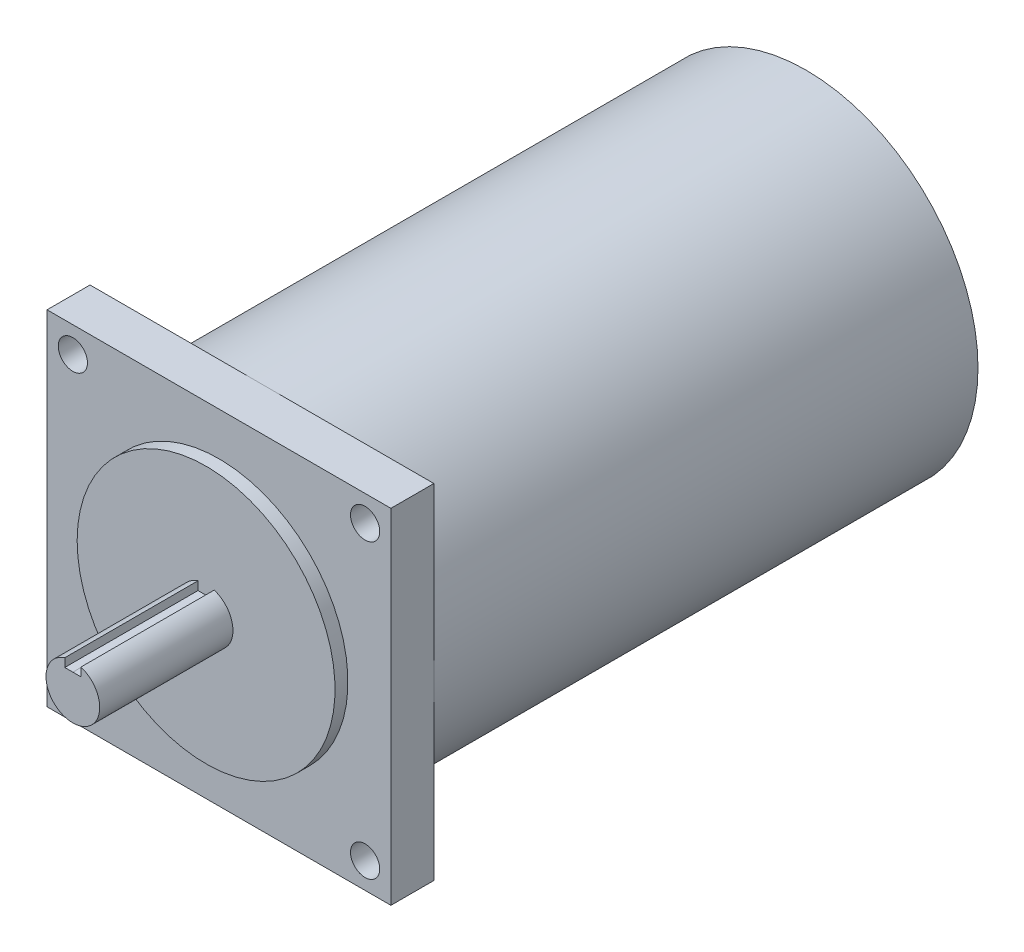
from build123d import *

# Parameters (mm, degrees)
SKETCH1_W               = 101.6
SKETCH1_H               = 101.6
SKETCH1_R               = 4.318
BOSS_EXTRUDE1_DEPTH     = 12.7
SKETCH2_R               = 38.1
BOSS_EXTRUDE2_DEPTH     = 3.81
SKETCH4_R               = 7.9375
BOSS_EXTRUDE4_DEPTH     = 39.37
CUT_EXTRUDE1_DEPTH      = 92.015682165
CUT_EXTRUDE1_DEPTH_BACK = 39.37
SKETCH6_R               = 50.8
BOSS_EXTRUDE5_DEPTH     = 160.782
BOSS_EXTRUDE6_START     = 3.81
SKETCH7_R               = 38.1
BOSS_EXTRUDE6_DEPTH     = 3.81
SKETCH8_R               = 6.35
BOSS_EXTRUDE7_DEPTH     = 17.78


with BuildPart() as part:
    # Sketch1 → Boss-Extrude1 (new body)
    with BuildSketch(Plane.XY):
        Rectangle(SKETCH1_W, SKETCH1_H)
        with Locations((-43.18, -43.18)):
            Circle(SKETCH1_R, mode=Mode.SUBTRACT)
        with Locations((43.18, -43.18)):
            Circle(SKETCH1_R, mode=Mode.SUBTRACT)
        with Locations((43.18, 43.18)):
            Circle(SKETCH1_R, mode=Mode.SUBTRACT)
        with Locations((-43.18, 43.18)):
            Circle(SKETCH1_R, mode=Mode.SUBTRACT)
    extrude(amount=BOSS_EXTRUDE1_DEPTH)

    # Sketch2 → Boss-Extrude2 (add)
    with BuildSketch(Plane.XY.offset(12.7)):
        Circle(SKETCH2_R)
    extrude(amount=BOSS_EXTRUDE2_DEPTH)

    # Sketch4 → Boss-Extrude4 (add)
    with BuildSketch(Plane.XY.offset(16.51)):
        Circle(SKETCH4_R)
    extrude(amount=BOSS_EXTRUDE4_DEPTH)

    # Sketch5 → Cut-Extrude1 (cut, two sides: drawn at the far end of the back side and taken through both)
    with BuildSketch(Plane.XY.offset(55.88).offset(-CUT_EXTRUDE1_DEPTH_BACK)):
        Polygon((2.387605482, 175.506150393), (2.387605482, 7.569890773), (2.387605482, 5.063803231), (5.482e-06, 5.063803231), (-2.387594518, 5.063803231), (-2.387594518, 7.569894231), (-2.387594518, 175.506153852), (-2.387351285, 511.378673093), (2.387848715, 511.378669635), align=None)
    extrude(amount=CUT_EXTRUDE1_DEPTH + CUT_EXTRUDE1_DEPTH_BACK, mode=Mode.SUBTRACT)

    # Sketch6 → Boss-Extrude5 (add)
    with BuildSketch(Plane(origin=(0, 0, 0), x_dir=(-1, 0, 0), z_dir=(0, 0, -1))):
        Circle(SKETCH6_R)
    extrude(amount=BOSS_EXTRUDE5_DEPTH)

    # Sketch7 → Boss-Extrude6 (add)
    with BuildSketch(Plane(origin=(0, 0, -160.782), x_dir=(-1, 0, 0), z_dir=(0, 0, -1)).offset(BOSS_EXTRUDE6_START)):
        Circle(SKETCH7_R)
    extrude(amount=-BOSS_EXTRUDE6_DEPTH)

    # Sketch8 → Boss-Extrude7 (add)
    with BuildSketch(Plane(origin=(0, 0, -164.592), x_dir=(-1, 0, 0), z_dir=(0, 0, -1))):
        Circle(SKETCH8_R)
    extrude(amount=BOSS_EXTRUDE7_DEPTH)


solid = part.part
